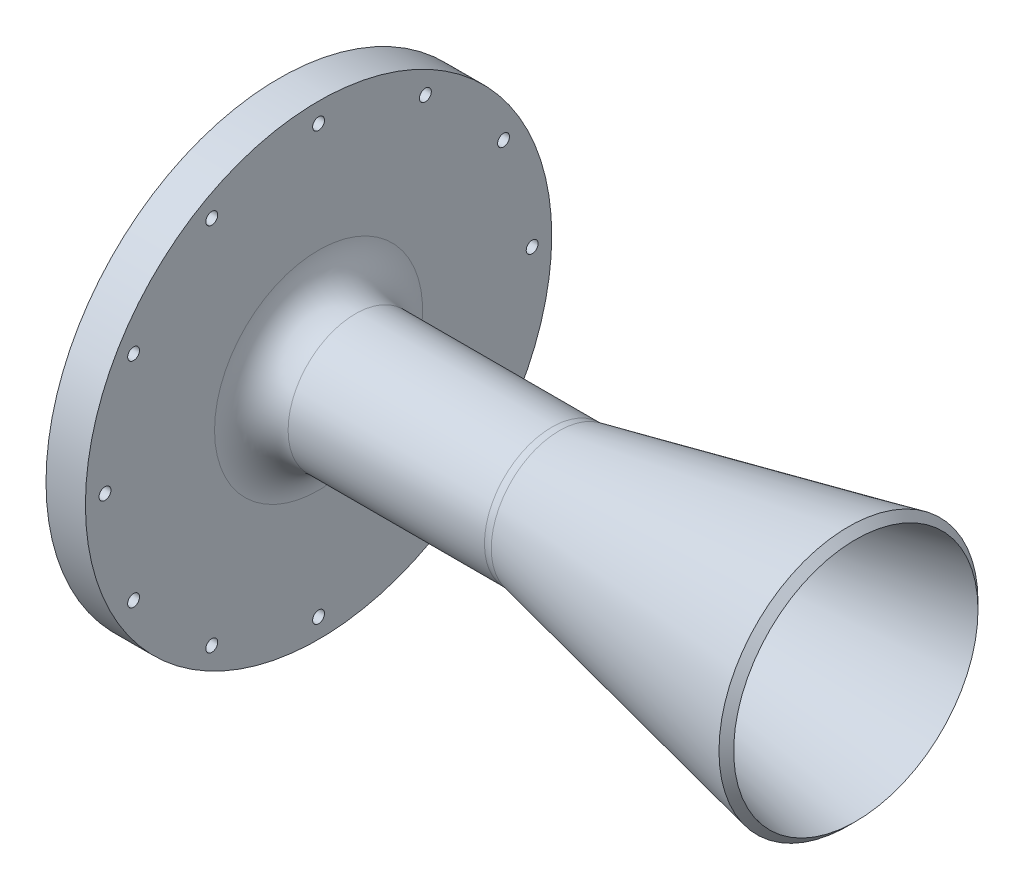
from build123d import *

# Parameters (mm, degrees)
FLANGE_HOLES_D    = 2.8702
DOWEL_HOLES_D     = 4.7625
DOWEL_HOLES_DEPTH = 6.35
DOWEL_HOLES_TIP   = 1.430799349
FILLET1_R         = 8.89
CHAMFER1_SIZE     = 2.141545552
CHAMFER1_SIZE_2   = 2.54


with BuildPart() as part:
    # Sketch2 → Main Structure (revolve)
    with BuildSketch(Plane.XY, mode=Mode.PRIVATE) as main_structure_sk:
        Polygon((0, 20.583496156), (0, 56.35625), (9.525, 56.35625), (9.525, 16.256), (66.806461084, 16.256), (139.7, 31.75), (139.7, 29.592458901), (60.325, 12.720781818), (60.325, 14.351), (10.795, 14.351), align=None)
    revolve(main_structure_sk.sketch.rotate(Axis((0, 0, 0), (1, 0, 0)), 90), axis=Axis((0, 0, 0), (1, 0, 0)))

    # Flange Holes (through all)
    with Locations(Plane.ZY):
        with Locations((0, -51.6255), (-25.81275, -44.708994483), (-44.708994483, -25.81275), (-51.6255, 0), (-44.708994483, 25.81275), (-25.81275, 44.708994483), (0, 51.6255), (25.81275, 44.708994483), (44.708994483, 25.81275), (51.6255, 0), (44.708994483, -25.81275), (25.81275, -44.708994483)):
            Hole(FLANGE_HOLES_D / 2)

    # Dowel Holes
    with Locations(Plane.ZY):
        with Locations((49.866403745, -13.361662613), (-49.866403745, 13.361662613)):
            Hole(DOWEL_HOLES_D / 2, depth=DOWEL_HOLES_DEPTH)
            with Locations((0, 0, -(DOWEL_HOLES_DEPTH + DOWEL_HOLES_TIP / 2))):  # 118° drill point
                Cone(0, DOWEL_HOLES_D / 2, DOWEL_HOLES_TIP, mode=Mode.SUBTRACT)

    # Fillet1
    fillet1_edges = [part.edges().sort_by_distance(p)[0] for p in [
        (66.806461084, 0, -16.256),
        (9.525, 0, -16.256),
    ]]
    fillet(fillet1_edges, radius=FILLET1_R)

    # Sketch13 → Cut-Revolve1 (revolve, cut)
    with BuildSketch(Plane(origin=(0, 0, 0), x_dir=(1, 0, 0), z_dir=(0, 1, 0)), mode=Mode.PRIVATE) as cut_revolve1_sk:
        Polygon((0, 38.1), (3.33331808, 0), (0, 0), align=None)
    revolve(cut_revolve1_sk.sketch.rotate(Axis((3.33331808, 0, 0), (-1, 0, 0)), 180), axis=Axis((3.33331808, 0, 0), (-1, 0, 0)), mode=Mode.SUBTRACT)

    # Chamfer1
    # the kernel refuses this chamfer: 3.297690964, 2.54, 2.141545552 mm, written as the material it takes off along each edge
    with BuildSketch(Plane(origin=(139.7, 0, 0), x_dir=(0, 0, 1), z_dir=(0, 1, 0))) as chamfer1_piece_1:
        Polygon((31.75 - CHAMFER1_SIZE * 0.207911690799, -CHAMFER1_SIZE * 0.978147600645), (31.75 - CHAMFER1_SIZE_2, 0), (31.75, 0), align=None)
    revolve(axis=Axis((139.7, 0, 0), (1, 0, 0)), mode=Mode.SUBTRACT)


solid = part.part
